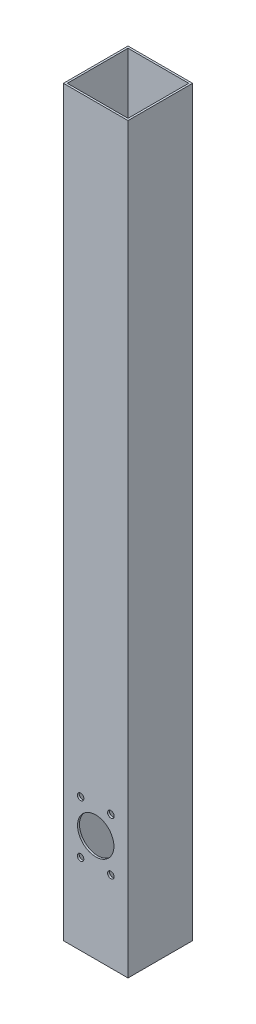
from build123d import *

# Parameters (mm, degrees)
SKETCH1_W               = 50.8
SKETCH1_H               = 50.8
SKETCH1_W_2             = 47.752
SKETCH1_H_2             = 47.752
EXTRUDE_THIN1_DEPTH     = 584.2
CUT_EXTRUDE1_DEPTH      = 586.303305988
CUT_EXTRUDE1_DEPTH_BACK = 586.303305988
SKETCH2_R               = 14.3002
SKETCH2_R_2             = 2.5908


with BuildPart() as part:
    # Sketch1 → Extrude-Thin1 (new body)
    with BuildSketch(Plane(origin=(0, 0, 0), x_dir=(1, 0, 0), z_dir=(0, 1, 0))):
        Rectangle(SKETCH1_W, SKETCH1_H)
        Rectangle(SKETCH1_W_2, SKETCH1_H_2, mode=Mode.SUBTRACT)
    extrude(amount=EXTRUDE_THIN1_DEPTH)

    # Sketch2 → Cut-Extrude1 (cut, two sides: drawn at the far end of the back side and taken through both)
    with BuildSketch(Plane.XY.offset(-CUT_EXTRUDE1_DEPTH_BACK)):
        with Locations((0, 84.1375)):
            Circle(SKETCH2_R)
        with Locations((-11.9126, 63.50427155)):
            Circle(SKETCH2_R_2)
        with Locations((11.9126, 63.50427155)):
            Circle(SKETCH2_R_2)
        with Locations((11.9126, 104.77072845)):
            Circle(SKETCH2_R_2)
        with Locations((-11.9126, 104.77072845)):
            Circle(SKETCH2_R_2)
    extrude(amount=CUT_EXTRUDE1_DEPTH + CUT_EXTRUDE1_DEPTH_BACK, mode=Mode.SUBTRACT)


solid = part.part
